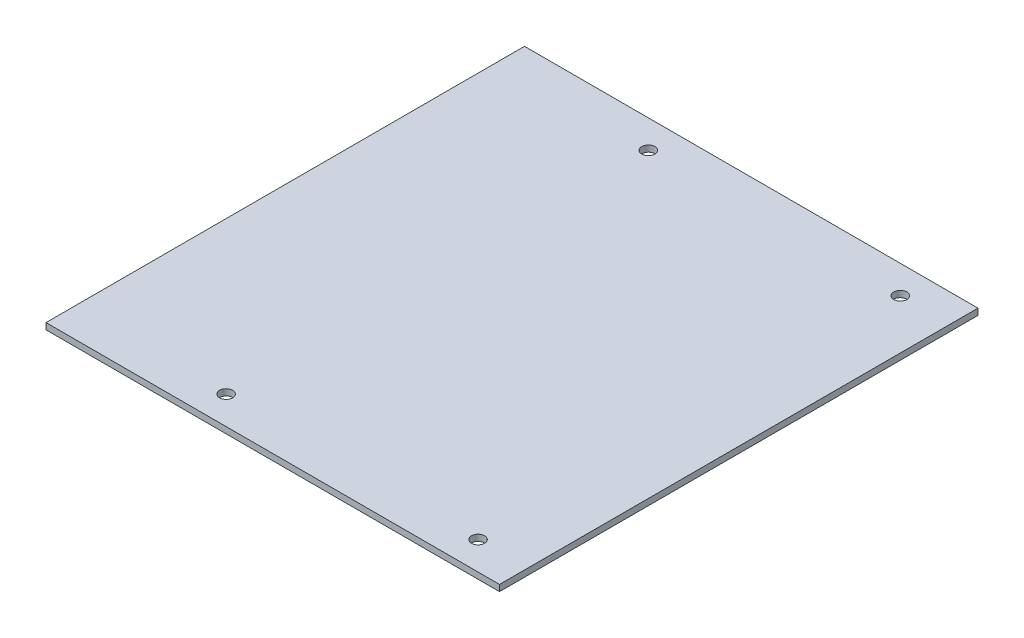
from build123d import *

# Parameters (mm, degrees)
SKETCH1_W            = 228.6
SKETCH1_H            = 241.2
BOSS_EXTRUDE1_DEPTH  = 1.5875
M6_CLEARANCE_HOLE1_D = 6.6


with BuildPart() as part:
    # Sketch1 → Boss-Extrude1 (new, symmetric)
    with BuildSketch(Plane(origin=(0, 0, 0), x_dir=(1, 0, 0), z_dir=(0, 1, 0))):
        with Locations((-254.65, 0)):
            Rectangle(SKETCH1_W, SKETCH1_H)
    extrude(amount=BOSS_EXTRUDE1_DEPTH, both=True)

    # M6 Clearance Hole1 (through all)
    with Locations(Plane(origin=(0, 1.5875, 0), x_dir=(1, 0, 0), z_dir=(0, 1, 0))):
        with Locations((-292.35, 106.425), (-165.35, 106.425), (-165.35, -106.425), (-292.35, -106.425)):
            Hole(M6_CLEARANCE_HOLE1_D / 2)


solid = part.part
